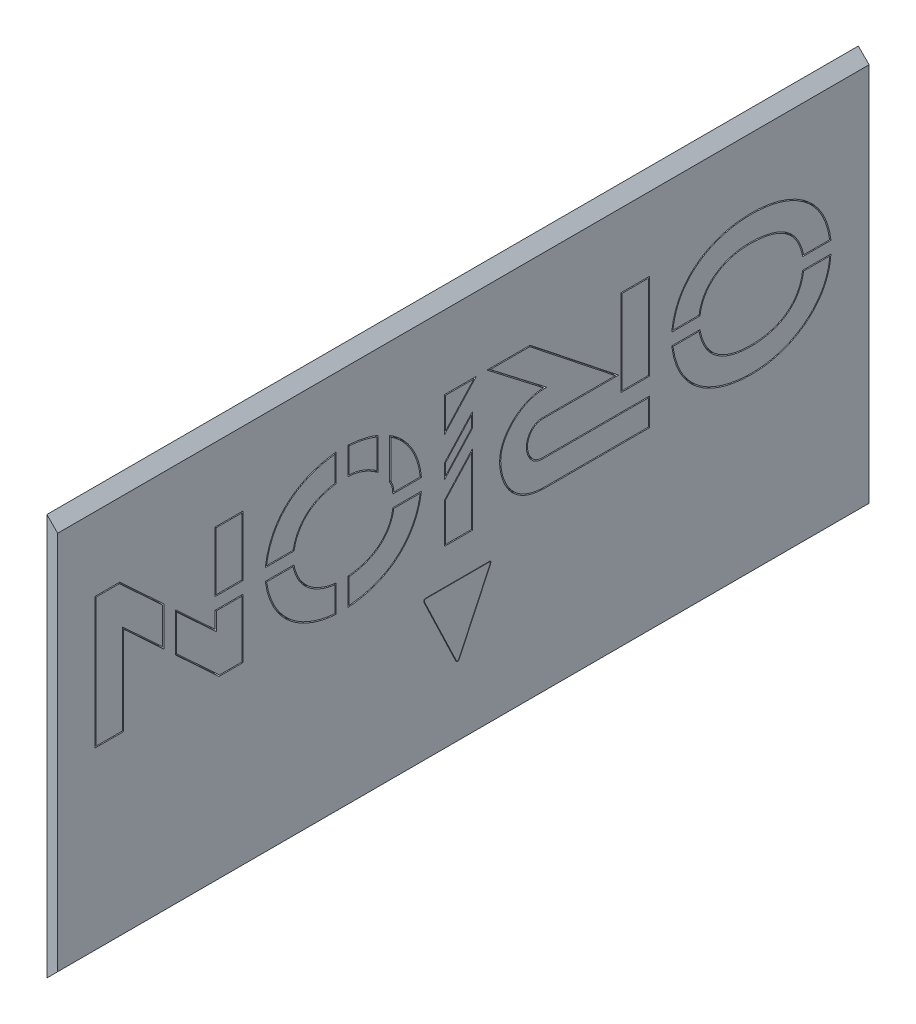
from build123d import *

# Parameters (mm, degrees)
BOSS_EXTRUDE1_DEPTH = 150
SKETCH2_R           = 2.35
CUT_EXTRUDE1_DEPTH  = 8
CUT_EXTRUDE2_START  = -8
SKETCH3_R           = 2.35
CUT_EXTRUDE2_DEPTH  = 8
CHAMFER1_SIZE       = 1
SKETCH4_W           = 20.1
SKETCH4_H           = 6
CUT_EXTRUDE3_DEPTH  = 158.321327226
CHAMFER2_SIZE       = 9.9
SKETCH5_R           = 2.35
CUT_EXTRUDE4_DEPTH  = 8
CHAMFER3_SIZE       = 1
SKETCH6_R           = 6.1
CUT_EXTRUDE5_DEPTH  = 3.2
SKETCH8_W           = 110
SKETCH8_H           = 21.9
CUT_EXTRUDE7_DEPTH  = 28
FILLET1_R           = 0.2
SKETCH9_W           = 80
SKETCH9_H           = 62.8
BOSS_EXTRUDE2_DEPTH = 3
SKETCH14_W          = 5.239877573
SKETCH14_H          = 15.985748595
SKETCH14_W_2        = 5.162010056
SKETCH14_H_2        = 11.128808668
CUT_EXTRUDE8_DEPTH  = 1
SKETCH15_W          = 4.762010056
SKETCH15_H          = 10.728808668
SKETCH15_W_2        = 4.839877573
SKETCH15_H_2        = 15.585748595
BOSS_EXTRUDE3_DEPTH = 1
SKETCH16_W          = 34.381364175
SKETCH16_H          = 98.219282504
CUT_EXTRUDE9_DEPTH  = 158.32132733


with BuildPart() as part:
    # Sketch1 → Boss-Extrude1 (new body)
    with BuildSketch(Plane.XY):
        Polygon((-15, 45), (15, 45), (15, -45), (-15, -45), (-15, -10.9), (13, -10.9), (13, 30), (-15, 30), align=None)
    extrude(amount=BOSS_EXTRUDE1_DEPTH)

    # Sketch2 → Cut-Extrude1 (cut)
    with BuildSketch(Plane.XY.offset(150)):
        with Locations((7.5, 33.89)):
            Circle(SKETCH2_R)
        with Locations(Location((-2.3, 33.89, 0), (0, 0, 180))):
            Circle(SKETCH2_R)
        with Locations(Location((7.5, -14.79, 0), (0, 0, 180))):
            Circle(SKETCH2_R)
        with Locations((-2.3, -14.79)):
            Circle(SKETCH2_R)
    extrude(amount=-CUT_EXTRUDE1_DEPTH, mode=Mode.SUBTRACT)

    # Sketch3 → Cut-Extrude2 (cut)
    with BuildSketch(Plane(origin=(0, 0, 0), x_dir=(-1, 0, 0), z_dir=(0, 0, -1)).offset(CUT_EXTRUDE2_START)):
        with Locations(Location((-7.5, 33.89, 0), (0, 0, 180))):
            Circle(SKETCH3_R)
        with Locations((2.3, 33.89)):
            Circle(SKETCH3_R)
        with Locations((-7.5, -14.79)):
            Circle(SKETCH3_R)
        with Locations(Location((2.3, -14.79, 0), (0, 0, 180))):
            Circle(SKETCH3_R)
    extrude(amount=CUT_EXTRUDE2_DEPTH, mode=Mode.SUBTRACT)

    # Chamfer1
    chamfer1_edges = [part.edges().sort_by_distance(p)[0] for p in [
        (0.05, 33.89, 150),
        (9.85, -14.79, 150),
        (-4.65, -14.79, 150),
        (5.15, 33.89, 150),
        (0.05, 33.89, 0),
        (9.85, -14.79, 0),
        (-4.65, -14.79, 0),
        (5.15, 33.89, 0),
    ]]
    chamfer(chamfer1_edges, length=CHAMFER1_SIZE)

    # Sketch4 → Cut-Extrude3 (cut, through all)
    with BuildSketch(Plane.XY.offset(150)):
        with Locations((-4.95, -42)):
            Rectangle(SKETCH4_W, SKETCH4_H)
        with Locations((-4.95, 42)):
            Rectangle(SKETCH4_W, SKETCH4_H)
    extrude(amount=-CUT_EXTRUDE3_DEPTH, mode=Mode.SUBTRACT)

    # Chamfer2
    chamfer2_edges = [part.edges().sort_by_distance(p)[0] for p in [
        (15, -45, 75),
        (15, 45, 75),
    ]]
    chamfer(chamfer2_edges, length=CHAMFER2_SIZE - 0.0001)  # a hair under: the kernel refuses the full size

    # Sketch5 → Cut-Extrude4 (cut)
    with BuildSketch(Plane(origin=(0, 39, 0), x_dir=(1, 0, 0), z_dir=(0, 1, 0))):
        with Locations(Location((-4.95, -25, 0), (0, 0, 270))):
            Circle(SKETCH5_R)
        with Locations(Location((-4.95, -50, 0), (0, 0, 270))):
            Circle(SKETCH5_R)
        with Locations(Location((-4.95, -100, 0), (0, 0, 270))):
            Circle(SKETCH5_R)
        with Locations(Location((-4.95, -125, 0), (0, 0, 270))):
            Circle(SKETCH5_R)
    extrude(amount=-CUT_EXTRUDE4_DEPTH, mode=Mode.SUBTRACT)

    # Chamfer3
    chamfer3_edges = [part.edges().sort_by_distance(p)[0] for p in [
        (-4.95, 39, 22.65),
        (-4.95, 39, 47.65),
        (-4.95, 39, 97.65),
        (-4.95, 39, 122.65),
    ]]
    chamfer(chamfer3_edges, length=CHAMFER3_SIZE)

    # Sketch6 → Cut-Extrude5 (cut)
    with BuildSketch(Plane.XZ.offset(39)):
        with Locations(Location((-5, 59.666666667, 0), (0, 0, 270))):
            Circle(SKETCH6_R)
        with Locations(Location((-5, 90.333333333, 0), (0, 0, 270))):
            Circle(SKETCH6_R)
    extrude(amount=-CUT_EXTRUDE5_DEPTH, mode=Mode.SUBTRACT)

    # Sketch8 → Cut-Extrude7 (cut)
    with BuildSketch(Plane.ZY.offset(15)):
        with Locations((75, -21.85)):
            Rectangle(SKETCH8_W, SKETCH8_H)
    extrude(amount=-CUT_EXTRUDE7_DEPTH, mode=Mode.SUBTRACT)

    # Fillet1
    fillet1_edges = [part.edges().sort_by_distance(p)[0] for p in [
        (-5, -39, 65.766666667),
        (-5, -39, 96.433333333),
    ]]
    fillet(fillet1_edges, radius=FILLET1_R)

    # Sketch9 → Boss-Extrude2 (add)
    with BuildSketch(Plane.ZY.offset(-13)):
        with Locations((75, -1.4)):
            Rectangle(SKETCH9_W, SKETCH9_H)
    extrude(amount=BOSS_EXTRUDE2_DEPTH)

    # Sketch14 → Cut-Extrude8 (cut)
    with BuildSketch(Plane(origin=(15, 0, 0), x_dir=(0, 0, -1), z_dir=(1, 0, 0))):
        with BuildLine():
            add(Edge.make_bspline(
                [(-36.495605371, 10.527266051), (-35.606611421, 18.782508471), (-21.841632144, 25.659853111), (-8.055982471, 18.937904469), (-7.066085705, 10.527266051)],
                knots=[0, 0, 0, 0, 0.49729852, 1, 1, 1, 1], degree=3))
            Line((-36.495605371, 10.527266051), (-31.27212237, 10.527266051))
            add(Edge.make_bspline(
                [(-31.27212237, 10.527266051), (-30.782455511, 14.495178515), (-26.837087438, 17.539375238), (-16.967357317, 17.394766524), (-13.183729515, 15.184827603), (-12.288625681, 10.527266051)],
                knots=[0, 0, 0, 0, 0.449389601, 0.549389601, 1, 1, 1, 1], degree=3))
            Line((-12.288625681, 10.527266051), (-7.066085705, 10.527266051))
        make_face()
        with BuildLine():
            Line((-31.27212237, 8.332364301), (-36.495605371, 8.332364301))
            add(Edge.make_bspline(
                [(-36.495605371, 8.332364301), (-35.571612197, 0.731696062), (-28.935635191, -3.600460934), (-14.091021606, -3.709813454), (-7.404222627, 1.82979959), (-7.066018932, 8.332364301)],
                knots=[0, 0, 0, 0, 0.42989922, 0.52989922, 1, 1, 1, 1], degree=3))
            Line((-7.066018932, 8.332364301), (-12.288625681, 8.332364301))
            add(Edge.make_bspline(
                [(-31.27212237, 8.332364301), (-30.355266701, 3.299743765), (-26.238828233, 1.115812747), (-17.203156987, 1.102363999), (-12.890664932, 3.583772765), (-12.288625681, 8.332364301)],
                knots=[0, 0, 0, 0, 0.434183969, 0.534183969, 1, 1, 1, 1], degree=3))
        make_face()
        with BuildLine():
            Line((-60.095552509, -2.702507791), (-40.588788824, -2.702507791))
            Line((-40.588788824, -2.702507791), (-40.588788824, 2.374178356))
            Line((-40.588788824, 2.374178356), (-60.476186142, 2.374178356))
            add(Edge.make_bspline(
                [(-60.476186142, 2.374178356), (-62.206823572, 2.416470634), (-63.162487076, 4.31796462), (-63.178008942, 6.733553948), (-62.168545666, 8.508420898), (-60.465125431, 8.57296241)],
                knots=[0, 0, 0, 0, 0.456599796, 0.556599796, 1, 1, 1, 1], degree=3))
            Line((-60.465125431, 8.57296241), (-46.325984318, 8.57296241))
            Line((-46.325984318, 8.57296241), (-62.667828603, 21.532658645))
            Line((-62.667828603, 21.532658645), (-70.631904142, 21.532658645))
            Line((-70.631904142, 21.532658645), (-60.185427294, 13.471424046))
            add(Edge.make_bspline(
                [(-60.095552509, -2.702507791), (-65.209774447, -2.645365646), (-68.160158969, 1.409640322), (-68.503917635, 9.560837257), (-64.02396644, 13.443848795), (-60.185427294, 13.471424046)],
                knots=[0, 0, 0, 0, 0.45572746, 0.55572746, 1, 1, 1, 1], degree=3))
        make_face()
        with Locations((-43.229108326, 13.539784348)):
            Rectangle(SKETCH14_W, SKETCH14_H)
        Polygon((-78.523050455, -2.745537739), (-73.295745914, -2.745537739), (-73.295745914, 10.320552095), (-78.523050455, 4.612886686), align=None)
        Polygon((-78.523050455, 7.883656054), (-73.295745914, 13.591321464), (-73.295745914, 16.289231623), (-78.523050455, 10.581566213), align=None)
        Polygon((-72.612153323, 21.532658645), (-78.523050455, 21.532658645), (-78.523050455, 15.078582201), align=None)
        with BuildLine():
            add(Edge.make_bspline(
                [(-70.25277074, -9.305969017), (-69.877028749, -9.307242391), (-69.846303583, -9.553213605), (-70.029991998, -9.939892146)],
                knots=[0, 0, 0, 0, 1, 1, 1, 1], degree=3))
            Line((-70.25277074, -9.305969017), (-81.920970846, -9.305969017))
            add(Edge.make_bspline(
                [(-81.920970846, -9.305969017), (-82.475118437, -9.315272479), (-82.323170908, -9.769201843), (-82.155628449, -10.131704416)],
                knots=[0, 0, 0, 0, 1, 1, 1, 1], degree=3))
            Line((-82.155628449, -10.131704416), (-76.422444417, -22.127644697))
            add(Edge.make_bspline(
                [(-76.422444417, -22.127644697), (-76.264195462, -22.462370015), (-75.914336003, -22.457186236), (-75.759121828, -22.133083912)],
                knots=[0, 0, 0, 0, 1, 1, 1, 1], degree=3))
            Line((-75.759121828, -22.133083912), (-70.029991998, -9.939892146))
        make_face()
        with BuildLine():
            add(Edge.make_bspline(
                [(-82.757372043, 8.201337904), (-83.49122839, 2.269901705), (-87.84388843, -3.009701843), (-96.311482165, -3.611728777)],
                knots=[0, 0, 0, 0, 1, 1, 1, 1], degree=3))
            Line((-82.757372043, 8.201337904), (-88.047074311, 8.201337904))
            add(Edge.make_bspline(
                [(-88.047074311, 8.201337904), (-88.453054328, 4.67264198), (-91.167722243, 1.858145488), (-96.311482165, 1.395325588)],
                knots=[0, 0, 0, 0, 1, 1, 1, 1], degree=3))
            Line((-96.311482165, 1.395325588), (-96.311482165, -3.611728777))
        make_face()
        with BuildLine():
            add(Edge.make_bspline(
                [(-98.506396616, 1.395325588), (-101.94199152, 1.756063723), (-105.470077888, 3.743984793), (-106.321714617, 8.201337904)],
                knots=[0, 0, 0, 0, 1, 1, 1, 1], degree=3))
            Line((-106.321714617, 8.201337904), (-111.62972679, 8.201337904))
            add(Edge.make_bspline(
                [(-111.62972679, 8.201337904), (-110.498137645, 0.183158852), (-104.369151909, -3.238525948), (-98.506396616, -3.611728777)],
                knots=[0, 0, 0, 0, 1, 1, 1, 1], degree=3))
            Line((-98.506396616, -3.611728777), (-98.506396616, 1.395325588))
        make_face()
        with BuildLine():
            Line((-88.047074311, 10.403849977), (-82.757372043, 10.403849977))
            add(Edge.make_bspline(
                [(-82.757372043, 10.403849977), (-83.100984418, 14.653503397), (-85.370149664, 18.106707004), (-88.616757465, 20.047555791)],
                knots=[0, 0, 0, 0, 1, 1, 1, 1], degree=3))
            Line((-88.616757465, 20.047555791), (-88.616757465, 12.531774895))
            add(Edge.make_bspline(
                [(-88.047074311, 10.403849977), (-88.06976577, 11.148610746), (-88.165231263, 11.886276459), (-88.616757465, 12.531774895)],
                knots=[0, 0, 0, 0, 1, 1, 1, 1], degree=3))
        make_face()
        with BuildLine():
            add(Edge.make_bspline(
                [(-96.311482165, 17.295692442), (-94.353972983, 17.290642151), (-92.565150799, 16.51196585), (-90.806559935, 15.250541947)],
                knots=[0, 0, 0, 0, 1, 1, 1, 1], degree=3))
            Line((-90.806559935, 15.250541947), (-90.806559935, 21.165489187))
            add(Edge.make_bspline(
                [(-96.311482165, 22.378874758), (-94.377449092, 22.245646794), (-92.53966644, 21.891478925), (-90.806559935, 21.165489187)],
                knots=[0, 0, 0, 0, 1, 1, 1, 1], degree=3))
            Line((-96.311482165, 22.378874758), (-96.311482165, 17.295692442))
        make_face()
        with BuildLine():
            add(Edge.make_bspline(
                [(-98.506396616, 17.295692442), (-101.949125048, 16.835586591), (-105.438710607, 15.12335245), (-106.321714617, 10.403849977)],
                knots=[0, 0, 0, 0, 1, 1, 1, 1], degree=3))
            Line((-98.506396616, 17.295692442), (-98.506396616, 22.378874758))
            add(Edge.make_bspline(
                [(-111.62972679, 10.403849977), (-110.526812286, 18.675072508), (-104.390796669, 21.713247439), (-98.506396616, 22.378874758)],
                knots=[0, 0, 0, 0, 1, 1, 1, 1], degree=3))
            Line((-111.62972679, 10.403849977), (-106.321714617, 10.403849977))
        make_face()
        Polygon((-128.19910973, 4.711913352), (-120.184142907, -2.736667957), (-115.769421715, -2.736667957), (-115.769421715, 8.210802226), (-120.87783476, 8.210802226), (-120.87783476, 5.136134907), (-128.19910973, 11.940044781), align=None)
        with Locations((-118.326847214, 15.968254311)):
            Rectangle(SKETCH14_W_2, SKETCH14_H_2)
        Polygon((-138.521140018, 21.532658645), (-143.083148978, 21.532658645), (-143.083148978, -2.736667957), (-137.821722051, -2.736667957), (-137.821722051, 13.654534308), (-130.388868015, 6.746930213), (-130.388868015, 13.975061642), align=None)
    extrude(amount=-CUT_EXTRUDE8_DEPTH, mode=Mode.SUBTRACT)

    # Sketch15 → Boss-Extrude3 (add)
    with BuildSketch(Plane(origin=(14, 0, 0), x_dir=(0, 0, -1), z_dir=(1, 0, 0))):
        Polygon((-142.883148978, 21.332658645), (-142.883148978, -2.536667957), (-138.021722051, -2.536667957), (-138.021722051, 14.113433103), (-130.588868015, 7.205829008), (-130.588868015, 13.887896453), (-138.599725317, 21.332658645), align=None)
        with Locations((-118.326847214, 15.968254311)):
            Rectangle(SKETCH15_W, SKETCH15_H)
        Polygon((-115.969421715, 8.010802226), (-120.67783476, 8.010802226), (-120.67783476, 4.677236112), (-127.99910973, 11.481145986), (-127.99910973, 4.79907854), (-120.105557607, -2.536667957), (-115.969421715, -2.536667957), align=None)
        with BuildLine():
            Line((-82.985440944, 8.001337904), (-87.870738741, 8.001337904))
            add(Edge.make_bspline(
                [(-87.870738741, 8.001337904), (-87.988168444, 7.14678225), (-88.51271616, 5.457335402), (-89.875421983, 3.733863575), (-91.393375425, 2.630444065), (-92.742293601, 1.964288406), (-94.045785857, 1.556041453), (-95.186535659, 1.326999739), (-95.806165904, 1.244653787), (-96.111482165, 1.213581998)],
                knots=[0.016375682, 0.016375682, 0.016375682, 0.016375682, 0.25935345, 0.502331218, 0.623820102, 0.745308986, 0.86679787, 0.927542312, 0.988286754, 0.988286754, 0.988286754, 0.988286754], degree=3))
            Line((-96.111482165, 1.213581998), (-96.111482165, -3.395928095))
            add(Edge.make_bspline(
                [(-96.111482165, -3.395928095), (-95.616317089, -3.355731413), (-94.609804982, -3.237132274), (-92.769179574, -2.874051756), (-90.679796986, -2.189412563), (-88.537667082, -1.046649204), (-86.14538548, 0.849421654), (-84.012580408, 3.799385878), (-83.182950913, 6.588352523), (-82.985440944, 8.001337904)],
                knots=[0.008545665, 0.008545665, 0.008545665, 0.008545665, 0.069710684, 0.130875703, 0.253205741, 0.375535779, 0.497865818, 0.742525894, 0.987185971, 0.987185971, 0.987185971, 0.987185971], degree=3))
        make_face()
        with BuildLine():
            Line((-106.485739933, 8.001337904), (-111.397968369, 8.001337904))
            add(Edge.make_bspline(
                [(-111.397968369, 8.001337904), (-111.325902109, 7.535765598), (-111.138066229, 6.592208974), (-110.634049826, 4.888920018), (-109.764901931, 2.989191884), (-108.401348295, 1.090210075), (-106.229260156, -0.972283827), (-102.978026723, -2.71007082), (-100.137138506, -3.288020996), (-98.706396616, -3.397244752)],
                knots=[0.009639501, 0.009639501, 0.009639501, 0.009639501, 0.070772623, 0.131905745, 0.25417199, 0.376438235, 0.49870448, 0.74323697, 0.98776946, 0.98776946, 0.98776946, 0.98776946], degree=3))
            Line((-98.706396616, -3.397244752), (-98.706396616, 1.216670329))
            add(Edge.make_bspline(
                [(-98.706396616, 1.216670329), (-99.564775012, 1.320665336), (-101.257615127, 1.721853441), (-103.214777633, 2.783978589), (-104.544928768, 4.0081712), (-105.395114168, 5.121418693), (-105.954296645, 6.221214592), (-106.295110707, 7.199362479), (-106.430383108, 7.73536585), (-106.485739933, 8.001337904)],
                knots=[0.017064321, 0.017064321, 0.017064321, 0.017064321, 0.259801123, 0.502537924, 0.623906325, 0.745274726, 0.866643127, 0.927327328, 0.988011528, 0.988011528, 0.988011528, 0.988011528], degree=3))
        make_face()
        with BuildLine():
            Line((-111.399827671, 10.603849977), (-106.486510996, 10.603849977))
            add(Edge.make_bspline(
                [(-106.486510996, 10.603849977), (-106.429893605, 10.883366383), (-106.291373766, 11.449144654), (-105.946890445, 12.466409954), (-105.385015229, 13.594971273), (-104.533999021, 14.714827962), (-103.204403246, 15.924047549), (-101.253120825, 16.945227431), (-99.561166459, 17.345064086), (-98.706396616, 17.469691601)],
                knots=[0.011404175, 0.011404175, 0.011404175, 0.011404175, 0.072155909, 0.132907644, 0.254411114, 0.375914583, 0.497418053, 0.740424992, 0.98343193, 0.98343193, 0.98343193, 0.98343193], degree=3))
            Line((-98.706396616, 17.469691601), (-98.706396616, 22.153842934))
            add(Edge.make_bspline(
                [(-98.706396616, 22.153842934), (-100.144645896, 21.976465562), (-103.001373724, 21.34101895), (-106.25649924, 19.631094607), (-108.425538596, 17.595916907), (-109.78407548, 15.705682401), (-110.647358559, 13.789487469), (-111.145192744, 12.05417218), (-111.329876942, 11.081989507), (-111.399827671, 10.603849977)],
                knots=[0.01270983, 0.01270983, 0.01270983, 0.01270983, 0.257212065, 0.501714299, 0.623965416, 0.746216533, 0.86846765, 0.929593209, 0.990718767, 0.990718767, 0.990718767, 0.990718767], degree=3))
        make_face()
        with BuildLine():
            Line((-96.111482165, 22.163678225), (-96.111482165, 17.492563999))
            add(Edge.make_bspline(
                [(-96.111482165, 17.492563999), (-95.663305294, 17.479657655), (-94.76576637, 17.372676682), (-93.478249724, 16.990713743), (-92.231613141, 16.416201609), (-91.402008639, 15.904619623), (-91.006559935, 15.634677041)],
                knots=[0.033170497, 0.033170497, 0.033170497, 0.033170497, 0.260073814, 0.486977131, 0.713880449, 0.940783766, 0.940783766, 0.940783766, 0.940783766], degree=3))
            Line((-91.006559935, 15.634677041), (-91.006559935, 21.031728857))
            add(Edge.make_bspline(
                [(-91.006559935, 21.031728857), (-91.407355889, 21.195055992), (-92.224957548, 21.483681194), (-93.483828518, 21.807202627), (-94.775296688, 22.034180713), (-95.667446643, 22.129138994), (-96.111482165, 22.163678225)],
                knots=[0.02391569, 0.02391569, 0.02391569, 0.02391569, 0.258633652, 0.493351613, 0.728069575, 0.962787537, 0.962787537, 0.962787537, 0.962787537], degree=3))
        make_face()
        with BuildLine():
            Line((-87.854876732, 10.603849977), (-82.975943861, 10.603849977))
            add(Edge.make_bspline(
                [(-82.975943861, 10.603849977), (-83.023113942, 11.089821278), (-83.173405279, 12.068099633), (-83.670623999, 13.893365991), (-84.644044443, 15.979999873), (-86.295968763, 18.094482391), (-87.674585821, 19.213849503), (-88.416757465, 19.688688509)],
                knots=[0.017259236, 0.017259236, 0.017259236, 0.017259236, 0.136113012, 0.254966788, 0.492674339, 0.730381891, 0.968089442, 0.968089442, 0.968089442, 0.968089442], degree=3))
            Line((-88.416757465, 19.688688509), (-88.416757465, 12.593548637))
            add(Edge.make_bspline(
                [(-88.416757465, 12.593548637), (-88.316145418, 12.442723493), (-88.141608397, 12.115743611), (-87.981056825, 11.620027832), (-87.890021805, 11.111829351), (-87.863363832, 10.773639057), (-87.854876732, 10.603849977)],
                knots=[0.025322901, 0.025322901, 0.025322901, 0.025322901, 0.24770771, 0.470092519, 0.692477327, 0.914862136, 0.914862136, 0.914862136, 0.914862136], degree=3))
        make_face()
        Polygon((-78.323050455, 15.593084989), (-73.066523087, 21.332658645), (-78.323050455, 21.332658645), align=None)
        Polygon((-78.323050455, 8.398158842), (-73.495745914, 13.669066426), (-73.495745914, 15.774728835), (-78.323050455, 10.503821251), align=None)
        Polygon((-73.495745914, 9.806049307), (-78.323050455, 4.535141723), (-78.323050455, -2.545537739), (-73.495745914, -2.545537739), align=None)
        with BuildLine():
            Line((-40.788788824, -2.502507791), (-40.788788824, 2.174178356))
            Line((-40.788788824, 2.174178356), (-60.478629517, 2.174178356))
            add(Edge.make_bspline(
                [(-60.478629517, 2.174178356), (-60.717429585, 2.180014009), (-61.211534996, 2.253234298), (-62.007569956, 2.607034328), (-62.748583315, 3.346875), (-63.240115263, 4.453972731), (-63.41442439, 5.491751805), (-63.272109269, 6.509859685), (-62.773435876, 7.600732008), (-62.017537342, 8.331143497), (-61.209649773, 8.685842714), (-60.710625122, 8.763804092), (-60.468913009, 8.77296241)],
                knots=[-0.000214817, -0.000214817, -0.000214817, -0.000214817, 0.062319134, 0.124853085, 0.249920987, 0.374988889, 0.500056791, 0.625124693, 0.750192596, 0.875260498, 0.937794449, 1.0003284, 1.0003284, 1.0003284, 1.0003284], degree=3))
            Line((-60.468913009, 8.77296241), (-46.900052219, 8.77296241))
            Line((-46.900052219, 8.77296241), (-62.737506771, 21.332658645))
            Line((-62.737506771, 21.332658645), (-70.045352748, 21.332658645))
            Line((-70.045352748, 21.332658645), (-59.604279353, 13.275593729))
            add(Edge.make_bspline(
                [(-59.604279353, 13.275593729), (-59.877894233, 13.273628138), (-60.43102263, 13.280488295), (-61.489759409, 13.173987249), (-63.316989081, 12.680483704), (-65.662303787, 11.219553996), (-67.309963498, 9.076663917), (-68.00614328, 7.159869976), (-68.156335085, 5.669736627), (-67.997745612, 4.149971847), (-67.630020964, 2.673497517), (-67.032237985, 1.293181271), (-66.195191376, 0.055376898), (-65.104914513, -0.99436357), (-63.748140829, -1.812155293), (-62.372164071, -2.262406851), (-61.130655901, -2.458959449), (-60.434050736, -2.498680842), (-60.09443049, -2.502507791)],
                knots=[-0.02236526, -0.02236526, -0.02236526, -0.02236526, 0.009582604, 0.041530468, 0.105426196, 0.233217652, 0.361009109, 0.424904837, 0.488800565, 0.552696293, 0.616592021, 0.680487749, 0.744383477, 0.808279205, 0.872174933, 0.936070661, 0.968018525, 0.999966389, 0.999966389, 0.999966389, 0.999966389], degree=3))
            Line((-60.09443049, -2.502507791), (-40.788788824, -2.502507791))
        make_face()
        with Locations((-43.229108326, 13.539784348)):
            Rectangle(SKETCH15_W_2, SKETCH15_H_2)
        with BuildLine():
            Line((-36.271326188, 10.727266051), (-31.44708417, 10.727266051))
            add(Edge.make_bspline(
                [(-31.44708417, 10.727266051), (-31.369617813, 11.262076268), (-31.100378969, 12.338040927), (-30.185844123, 14.184893922), (-28.389799172, 16.031596407), (-25.928824056, 17.154059031), (-23.677576946, 17.593186066), (-21.867593385, 17.678359299), (-20.075659748, 17.564309929), (-17.864399678, 17.195244868), (-15.927388588, 16.439163659), (-14.347848524, 15.200534338), (-13.364990604, 14.011380791), (-12.730369954, 12.784329509), (-12.344177154, 11.665459905), (-12.188310905, 11.037098603), (-12.124510079, 10.727266051)],
                knots=[0.006503148, 0.006503148, 0.006503148, 0.006503148, 0.068272612, 0.130042075, 0.253581001, 0.377119928, 0.438889391, 0.500658854, 0.562428317, 0.624197781, 0.747736707, 0.80950617, 0.871275634, 0.933045097, 0.963929828, 0.99481456, 0.99481456, 0.99481456, 0.99481456], degree=3))
            Line((-12.124510079, 10.727266051), (-7.292572578, 10.727266051))
            add(Edge.make_bspline(
                [(-7.292572578, 10.727266051), (-7.357259702, 11.218119602), (-7.537645384, 12.214488135), (-8.055701094, 14.001527072), (-8.99314283, 15.980047596), (-10.51134708, 17.930189521), (-12.978033223, 20.006890059), (-16.733878556, 21.660554493), (-21.796933262, 22.267045498), (-26.870696601, 21.632108901), (-30.636871913, 19.966338683), (-33.103183887, 17.889479075), (-34.614523698, 15.945251291), (-35.538987918, 13.97754062), (-36.041523551, 12.202795307), (-36.211890246, 11.214190884), (-36.271326188, 10.727266051)],
                knots=[0.004529657, 0.004529657, 0.004529657, 0.004529657, 0.035496645, 0.066463632, 0.128397608, 0.190331584, 0.252265559, 0.37613351, 0.500001462, 0.623869413, 0.747737364, 0.80967134, 0.871605315, 0.933539291, 0.964506279, 0.995473267, 0.995473267, 0.995473267, 0.995473267], degree=3))
        make_face()
        with BuildLine():
            Line((-31.43791012, 8.132364301), (-36.268354424, 8.132364301))
            add(Edge.make_bspline(
                [(-36.268354424, 8.132364301), (-36.198586222, 7.614390974), (-36.005811206, 6.561535349), (-35.459097668, 4.684383654), (-34.475958852, 2.61957367), (-32.887037113, 0.607416692), (-30.948623281, -0.977679162), (-28.72179985, -2.155939826), (-26.269372569, -2.94908944), (-23.654832143, -3.377904428), (-20.046199767, -3.48994759), (-15.730583183, -2.656443177), (-12.124003376, -0.63619725), (-9.864522805, 1.576580155), (-8.537447441, 3.5089122), (-7.780167448, 5.329131951), (-7.410227958, 6.89171484), (-7.307354569, 7.720661329), (-7.278570948, 8.132364301)],
                knots=[0.004297131, 0.004297131, 0.004297131, 0.004297131, 0.035251196, 0.066205261, 0.128113392, 0.190021523, 0.251929654, 0.313837784, 0.375745915, 0.437654046, 0.499562177, 0.623378438, 0.7471947, 0.80910283, 0.871010961, 0.932919092, 0.963873157, 0.994827223, 0.994827223, 0.994827223, 0.994827223], degree=3))
            Line((-7.278570948, 8.132364301), (-12.113856404, 8.132364301))
            add(Edge.make_bspline(
                [(-12.113856404, 8.132364301), (-12.15809854, 7.824585607), (-12.277516044, 7.200592904), (-12.611749704, 6.077556442), (-13.209100058, 4.831026596), (-14.174927029, 3.60115319), (-15.746185328, 2.293817057), (-18.138800152, 1.252069251), (-21.438013504, 0.818939168), (-24.803802267, 1.073811453), (-27.307180652, 1.967705785), (-29.00322801, 3.243884127), (-30.077467867, 4.507284387), (-30.778031666, 5.844704831), (-31.201483695, 7.082018023), (-31.370307995, 7.786155406), (-31.43791012, 8.132364301)],
                knots=[0.005648175, 0.005648175, 0.005648175, 0.005648175, 0.036575359, 0.067502543, 0.12935691, 0.191211277, 0.253065645, 0.37677438, 0.500483114, 0.624191849, 0.747900584, 0.809754951, 0.871609318, 0.933463686, 0.96439087, 0.995318053, 0.995318053, 0.995318053, 0.995318053], degree=3))
        make_face()
        with BuildLine():
            Line((-70.253109634, -9.405968442), (-81.920109552, -9.405969017))
            add(Edge.make_bspline(
                [(-81.920109552, -9.405969017), (-81.970398436, -9.406858607), (-82.087394977, -9.422349173), (-82.180115481, -9.478201545), (-82.224502479, -9.570720286), (-82.185678659, -9.815637216), (-82.105253523, -10.002341801), (-82.064854778, -10.089750385)],
                knots=[0.000546197, 0.000546197, 0.000546197, 0.000546197, 0.125477923, 0.250409648, 0.500273099, 0.750136549, 1, 1, 1, 1], degree=3))
            Line((-82.064854778, -10.089750385), (-76.332128625, -22.084713335))
            add(Edge.make_bspline(
                [(-76.332128625, -22.084713335), (-76.305108877, -22.141865015), (-76.212815716, -22.258643865), (-76.089763876, -22.286968567), (-75.966131764, -22.258029801), (-75.875926283, -22.145462999), (-75.84931263, -22.089891099)],
                knots=[-0.000189261, -0.000189261, -0.000189261, -0.000189261, 0.249858054, 0.499905369, 0.749952685, 1, 1, 1, 1], degree=3))
            Line((-75.84931263, -22.089891099), (-70.12040912, -9.8971746))
            add(Edge.make_bspline(
                [(-70.12040912, -9.8971746), (-70.083737887, -9.819978774), (-70.012878665, -9.633577422), (-70.02218688, -9.491250031), (-70.057395036, -9.446995614), (-70.138436231, -9.413139832), (-70.217990881, -9.406087459), (-70.253109634, -9.405968442)],
                knots=[-0.000164827, -0.000164827, -0.000164827, -0.000164827, 0.24987638, 0.499917587, 0.749958793, 0.874979397, 1, 1, 1, 1], degree=3))
        make_face()
    extrude(amount=BOSS_EXTRUDE3_DEPTH)

    # Sketch16 → Cut-Extrude9 (cut, through all)
    with BuildSketch(Plane.XY.offset(150)):
        with Locations((-4.190682088, -1.708161435)):
            Rectangle(SKETCH16_W, SKETCH16_H)
    extrude(amount=-CUT_EXTRUDE9_DEPTH, mode=Mode.SUBTRACT)


solid = part.part
